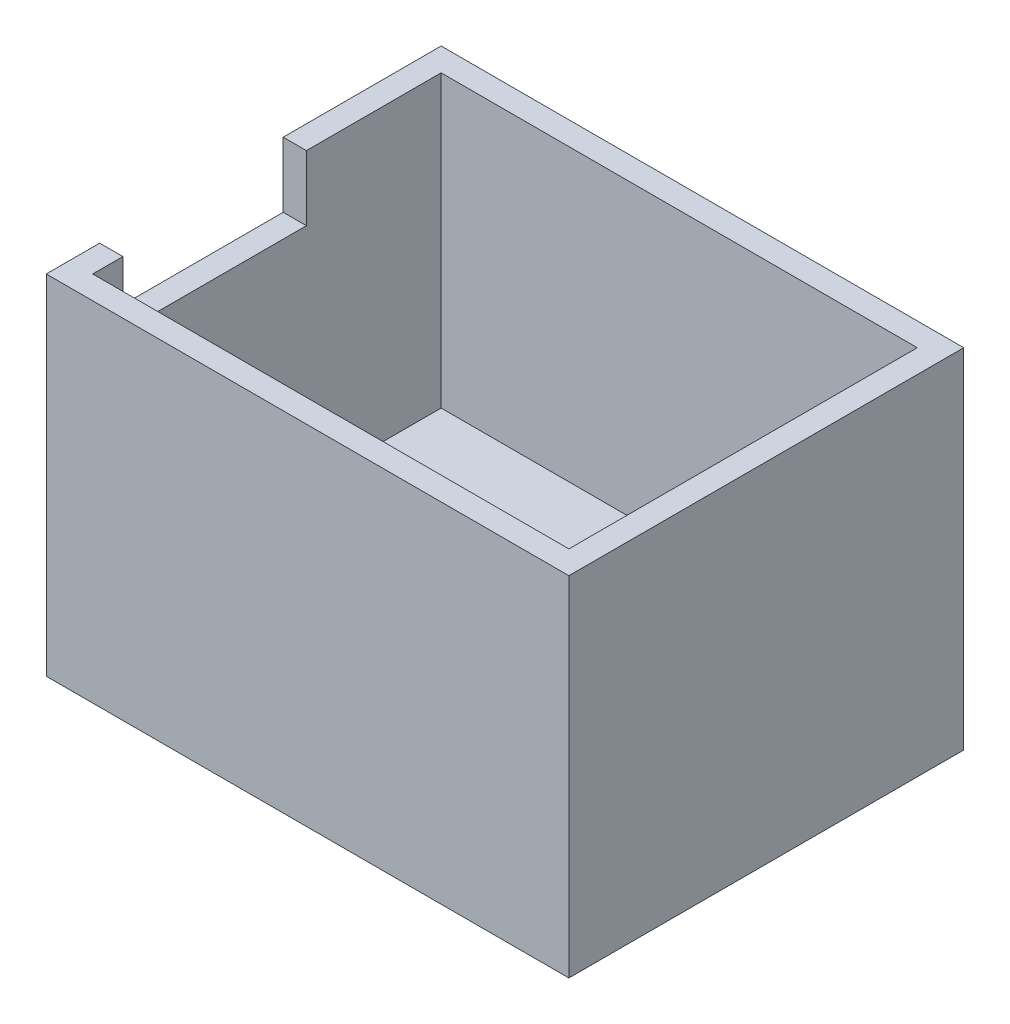
from build123d import *

# Parameters (mm, degrees)
SKETCH1_W             = 57.15
SKETCH1_H             = 43.18
BOSS_EXTRUDE1_DEPTH   = 38.1
SKETCH2_W             = 52.07
SKETCH2_H             = 38.1
CUT_EXTRUDE1_DEPTH    = 31.75
SKETCH3_W             = 18.034
SKETCH3_H             = 15.24
CUT_EXTRUDE2_DEPTH    = 53.290235465
CUT_EXTRUDE3_REACH    = 73.999
SKETCH4_W             = 20.066
SKETCH4_H             = 7.112
CUT_EXTRUDE4_REACH    = 54.29
F_4_CLEARANCE_HOLE1_D = 2.9464
F_6_CLEARANCE_HOLE1_D = 3.6576


with BuildPart() as part:
    # Sketch1 → Boss-Extrude1 (new body)
    with BuildSketch(Plane(origin=(0, 0, 0), x_dir=(1, 0, 0), z_dir=(0, 1, 0))):
        Rectangle(SKETCH1_W, SKETCH1_H)
    extrude(amount=BOSS_EXTRUDE1_DEPTH)

    # Sketch2 → Cut-Extrude1 (cut)
    with BuildSketch(Plane(origin=(0, 38.1, 0), x_dir=(1, 0, 0), z_dir=(0, 1, 0))):
        Rectangle(SKETCH2_W, SKETCH2_H)
    extrude(amount=-CUT_EXTRUDE1_DEPTH, mode=Mode.SUBTRACT)

    # Sketch3 → Cut-Extrude2 (cut, through all)
    with BuildSketch(Plane(origin=(0, 0, 0), x_dir=(-1, 0, 0), z_dir=(0, -1, 0))):
        with Locations((-1.524, 0)):
            Rectangle(SKETCH3_W, SKETCH3_H)
    extrude(amount=-CUT_EXTRUDE2_DEPTH, mode=Mode.SUBTRACT)

    # Sketch4 → Cut-Extrude3 (cut, up to next)
    with BuildSketch(Plane.ZY.offset(28.575), mode=Mode.PRIVATE) as cut_extrude3_sk1:
        with Locations((5.715, 34.544)):
            Rectangle(SKETCH4_W, SKETCH4_H)
    cut_extrude3_tool1 = extrude(cut_extrude3_sk1.sketch, amount=-CUT_EXTRUDE3_REACH, mode=Mode.PRIVATE) & part.part
    add(cut_extrude3_tool1.solids().sort_by_distance((-28.575, 34.544, 5.715))[0], mode=Mode.SUBTRACT)

    # Sketch5 → Cut-Extrude4 (cut, up to next)
    with BuildSketch(Plane.XZ, mode=Mode.PRIVATE) as cut_extrude4_sk1:
        with BuildLine():
            Line((17.624947543, -13.716), (24.228947543, -13.716))
            Line((24.228947543, -13.716), (24.228947543, 13.716))
            Line((24.228947543, 13.716), (17.624947543, 13.716))
            ThreePointArc((17.624947543, 13.716), (15.828896319, 12.972051224), (15.084947543, 11.176))
            Line((15.084947543, 11.176), (15.084947543, -11.176))
            ThreePointArc((15.084947543, -11.176), (15.828896319, -12.972051224), (17.624947543, -13.716))
        make_face()
    cut_extrude4_tool1 = extrude(cut_extrude4_sk1.sketch, amount=-CUT_EXTRUDE4_REACH, mode=Mode.PRIVATE) & part.part
    add(cut_extrude4_tool1.solids().sort_by_distance((19.701649, 0, 0))[0], mode=Mode.SUBTRACT)

    # #4 Clearance Hole1 (through all)
    with Locations(Plane(origin=(0, 0, 0), x_dir=(-1, 0, 0), z_dir=(0, -1, 0))):
        with Locations((-19.656947543, 16.256), (-19.656947543, -16.256)):
            Hole(F_4_CLEARANCE_HOLE1_D / 2)

    # #6 Clearance Hole1 (through all)
    with Locations(Plane(origin=(0, 0, 0), x_dir=(-1, 0, 0), z_dir=(0, -1, 0))):
        with Locations((3.175, 14.605), (3.175, -14.605)):
            Hole(F_6_CLEARANCE_HOLE1_D / 2)


solid = part.part
